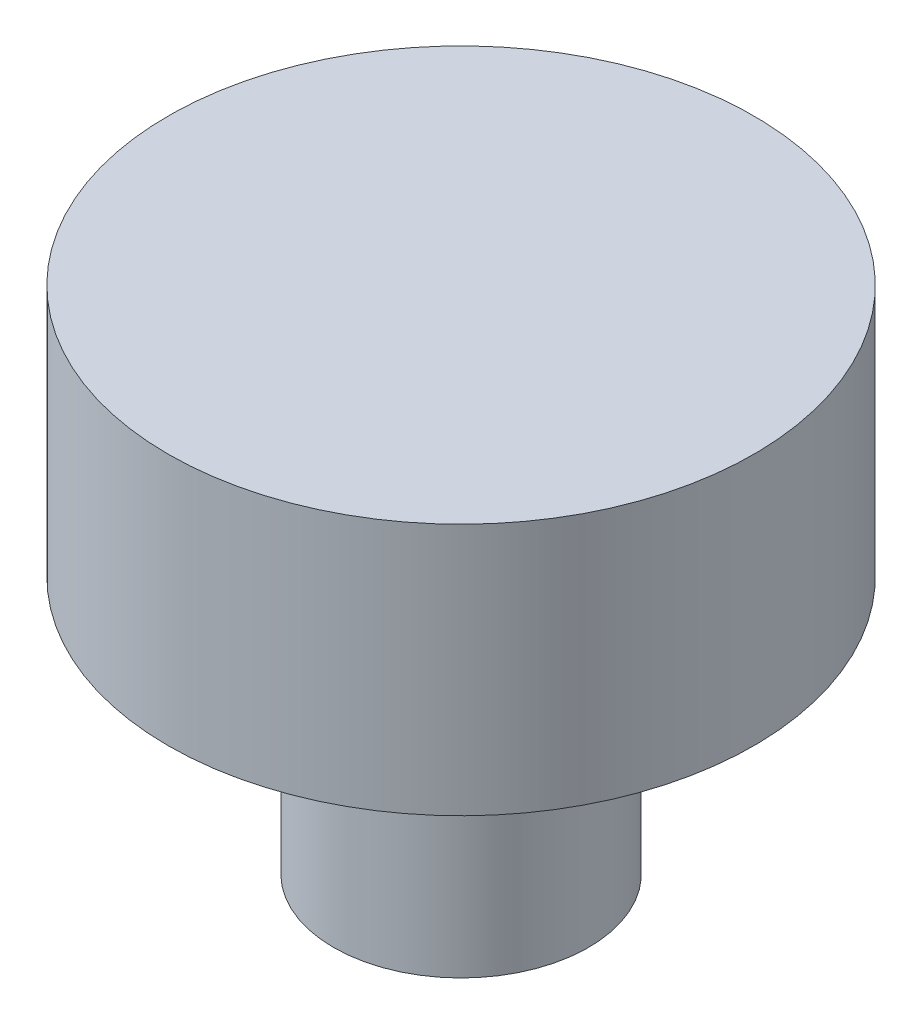
from build123d import *

# Parameters (mm, degrees)
SKETCH1_R           = 5.207
BOSS_EXTRUDE1_DEPTH = 10.5156
SKETCH2_R           = 11.9634
BOSS_EXTRUDE2_DEPTH = 10.3124


with BuildPart() as part:
    # Sketch1 → Boss-Extrude1 (new body)
    with BuildSketch(Plane(origin=(0, 0, 0), x_dir=(1, 0, 0), z_dir=(0, 1, 0))):
        Circle(SKETCH1_R)
    extrude(amount=BOSS_EXTRUDE1_DEPTH)

    # Sketch2 → Boss-Extrude2 (add)
    with BuildSketch(Plane(origin=(0, 10.5156, 0), x_dir=(1, 0, 0), z_dir=(0, 1, 0))):
        Circle(SKETCH2_R)
    extrude(amount=BOSS_EXTRUDE2_DEPTH)


solid = part.part
